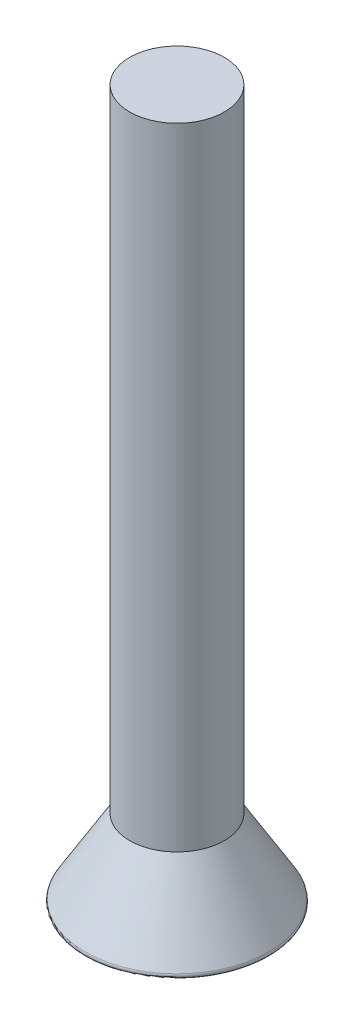
from build123d import *

# Parameters (mm, degrees)
SKETCH1_R           = 3
BOSS_EXTRUDE1_DEPTH = 2.5
SKETCH2_R           = 1.5
BOSS_EXTRUDE2_DEPTH = 20
CHAMFER1_SIZE       = 2.5
CHAMFER1_SIZE_2     = 1.5
FILLET1_R           = 0.1
SKETCH3_W           = 1
SKETCH3_H           = 1
CUT_EXTRUDE2_DEPTH  = 1.5
CHAMFER7_SIZE       = 1.5
CHAMFER7_SIZE_2     = 0.3


with BuildPart() as part:
    # Sketch1 → Boss-Extrude1 (new body)
    with BuildSketch(Plane(origin=(0, 0, 0), x_dir=(1, 0, 0), z_dir=(0, 1, 0))):
        with Locations(Location((0, 0, 0), (0, 0, 270))):
            Circle(SKETCH1_R)
    extrude(amount=BOSS_EXTRUDE1_DEPTH)

    # Sketch2 → Boss-Extrude2 (add)
    with BuildSketch(Plane(origin=(0, 2.5, 0), x_dir=(1, 0, 0), z_dir=(0, 1, 0))):
        with Locations(Location((0, 0, 0), (0, 0, 270))):
            Circle(SKETCH2_R)
    extrude(amount=BOSS_EXTRUDE2_DEPTH)

    # Chamfer1
    # the kernel refuses this chamfer: 2.5, 1.5 mm, written as the material it takes off along each edge
    with BuildSketch(Plane(origin=(0, 2.5, 0), x_dir=(0, 0, 1), z_dir=(-1, 0, 0))) as chamfer1_piece_1_section:
        Polygon((3, -CHAMFER1_SIZE), (3 - CHAMFER1_SIZE_2, 0), (3, 0), align=None)
    chamfer1_piece_1 = revolve(axis=Axis((0, 2.5, 0), (0, 1, 0)), mode=Mode.PRIVATE)
    chamfer1_piece_1 = chamfer1_piece_1 - Plane(origin=(0, 2.5, 0), x_dir=(0, 0, 1), z_dir=(0, -1, 0)) * Cylinder(1.5, 12, mode=Mode.PRIVATE)
    add(chamfer1_piece_1, mode=Mode.SUBTRACT)

    # Fillet1
    fillet1_edges = [part.edges().sort_by_distance(p)[0] for p in [
        (0, 0, -3),
    ]]
    fillet(fillet1_edges, radius=FILLET1_R)

    # Sketch3 → Cut-Extrude2 (cut)
    with BuildSketch(Plane.XZ):
        with Locations((0, -1)):
            Rectangle(SKETCH3_W, SKETCH3_H)
        with Locations((-1, 0)):
            Rectangle(SKETCH3_W, SKETCH3_H)
        Rectangle(SKETCH3_W, SKETCH3_H)
        with Locations((0, 1)):
            Rectangle(SKETCH3_W, SKETCH3_H)
        with Locations((1, 0)):
            Rectangle(SKETCH3_W, SKETCH3_H)
    extrude(amount=-CUT_EXTRUDE2_DEPTH, mode=Mode.SUBTRACT)

    # Chamfer7
    # the kernel refuses this chamfer: 1.5, 0.3 mm, written as the material it adds along each edge
    with BuildSketch(Plane(origin=(-0.5, 1.5, -1.5), x_dir=(0, -1, 0), z_dir=(1, 0, 0)), Plane(origin=(0.5, 1.5, 1.5), x_dir=(0, -1, 0), z_dir=(-1, 0, 0)), Plane(origin=(1.5, 1.5, 0.5), x_dir=(0, -1, 0), z_dir=(-1, 0, 0)), Plane(origin=(-0.5, 1.5, 1.5), x_dir=(0, -1, 0), z_dir=(0, 0, -1)), Plane(origin=(-1.5, 1.5, 0.5), x_dir=(0, -1, 0), z_dir=(0, 0, -1)), Plane(origin=(1.5, 1.5, -0.5), x_dir=(0, -1, 0), z_dir=(0, 0, 1)), Plane(origin=(0.5, 1.5, -0.5), x_dir=(0, -1, 0), z_dir=(1, 0, 0)), Plane(origin=(-1.5, 1.5, -0.5), x_dir=(0, -1, 0), z_dir=(1, 0, 0)), Plane(origin=(-0.5, 1.5, -0.5), x_dir=(0, -1, 0), z_dir=(0, 0, -1))) as chamfer7_piece_1:
        Polygon((CHAMFER7_SIZE, 0), (0, -CHAMFER7_SIZE_2), (0, 0), align=None)
    extrude(amount=1)
    with BuildSketch(Plane(origin=(0.5, 1.5, 1.5), x_dir=(0, -1, 0), z_dir=(0, 0, -1)), Plane(origin=(-1.5, 1.5, 0.5), x_dir=(0, -1, 0), z_dir=(1, 0, 0)), Plane(origin=(0.5, 1.5, -0.5), x_dir=(0, -1, 0), z_dir=(0, 0, -1))) as chamfer7_piece_2:
        Polygon((CHAMFER7_SIZE, 0), (0, CHAMFER7_SIZE_2), (0, 0), align=None)
    extrude(amount=1)
    with BuildSketch(Plane(origin=(0.5, 1.5, 5.397198129), x_dir=(0, -1, 0), z_dir=(0, 0, -1))) as chamfer7_piece_3_section:
        Polygon((CHAMFER7_SIZE, 0), (0, CHAMFER7_SIZE_2), (0, 0), align=None)
    chamfer7_piece_3 = extrude(amount=8.794396259, mode=Mode.PRIVATE)
    chamfer7_piece_3 = split(chamfer7_piece_3, bisect_by=Plane(origin=(0.5, 1.5, -0.5), z_dir=(0, 0, -1)), keep=Keep.TOP, mode=Mode.PRIVATE)
    chamfer7_piece_3 = split(chamfer7_piece_3, bisect_by=Plane(origin=(0.5, 1.5, -1.5), z_dir=(0, 0, 1)), keep=Keep.TOP, mode=Mode.PRIVATE)
    add(chamfer7_piece_3)
    with BuildSketch(Plane(origin=(5.397198129, 1.5, 0.5), x_dir=(0, -1, 0), z_dir=(-1, 0, 0))) as chamfer7_piece_4_section:
        Polygon((CHAMFER7_SIZE, 0), (0, -CHAMFER7_SIZE_2), (0, 0), align=None)
    chamfer7_piece_4 = extrude(amount=8.794396259, mode=Mode.PRIVATE)
    chamfer7_piece_4 = split(chamfer7_piece_4, bisect_by=Plane(origin=(-1.5, 1.5, 0.5), z_dir=(1, 0, 0)), keep=Keep.TOP, mode=Mode.PRIVATE)
    chamfer7_piece_4 = split(chamfer7_piece_4, bisect_by=Plane(origin=(-0.5, 1.5, 0.5), z_dir=(-1, 0, 0)), keep=Keep.TOP, mode=Mode.PRIVATE)
    add(chamfer7_piece_4)
    with BuildSketch(Plane(origin=(-0.5, 1.5, 5.397198129), x_dir=(0, -1, 0), z_dir=(0, 0, -1))) as chamfer7_piece_5_section:
        Polygon((CHAMFER7_SIZE, 0), (0, -CHAMFER7_SIZE_2), (0, 0), align=None)
    chamfer7_piece_5 = extrude(amount=8.794396259, mode=Mode.PRIVATE)
    chamfer7_piece_5 = split(chamfer7_piece_5, bisect_by=Plane(origin=(-0.5, 1.5, -0.5), z_dir=(0, 0, -1)), keep=Keep.TOP, mode=Mode.PRIVATE)
    chamfer7_piece_5 = split(chamfer7_piece_5, bisect_by=Plane(origin=(-0.5, 1.5, -1.5), z_dir=(0, 0, 1)), keep=Keep.TOP, mode=Mode.PRIVATE)
    add(chamfer7_piece_5)
    with BuildSketch(Plane(origin=(-5.397198129, 1.5, 0.5), x_dir=(0, -1, 0), z_dir=(1, 0, 0))) as chamfer7_piece_6_section:
        Polygon((CHAMFER7_SIZE, 0), (0, CHAMFER7_SIZE_2), (0, 0), align=None)
    chamfer7_piece_6 = extrude(amount=8.794396259, mode=Mode.PRIVATE)
    chamfer7_piece_6 = split(chamfer7_piece_6, bisect_by=Plane(origin=(0.5, 1.5, 0.5), z_dir=(1, 0, 0)), keep=Keep.TOP, mode=Mode.PRIVATE)
    chamfer7_piece_6 = split(chamfer7_piece_6, bisect_by=Plane(origin=(1.5, 1.5, 0.5), z_dir=(-1, 0, 0)), keep=Keep.TOP, mode=Mode.PRIVATE)
    add(chamfer7_piece_6)
    with BuildSketch(Plane(origin=(-3.397198129, 1.5, -0.5), x_dir=(0, -1, 0), z_dir=(1, 0, 0))) as chamfer7_piece_7_section:
        Polygon((CHAMFER7_SIZE, 0), (0, -CHAMFER7_SIZE_2), (0, 0), align=None)
    chamfer7_piece_7 = extrude(amount=8.794396259, mode=Mode.PRIVATE)
    chamfer7_piece_7 = split(chamfer7_piece_7, bisect_by=Plane(origin=(-1.5, 1.5, -0.5), z_dir=(1, 0, 0)), keep=Keep.TOP, mode=Mode.PRIVATE)
    chamfer7_piece_7 = split(chamfer7_piece_7, bisect_by=Plane(origin=(-0.5, 1.5, -0.5), z_dir=(-1, 0, 0)), keep=Keep.TOP, mode=Mode.PRIVATE)
    add(chamfer7_piece_7)
    with BuildSketch(Plane(origin=(0.5, 1.5, 3.397198129), x_dir=(0, -1, 0), z_dir=(0, 0, -1))) as chamfer7_piece_8_section:
        Polygon((CHAMFER7_SIZE, 0), (0, CHAMFER7_SIZE_2), (0, 0), align=None)
    chamfer7_piece_8 = extrude(amount=8.794396259, mode=Mode.PRIVATE)
    chamfer7_piece_8 = split(chamfer7_piece_8, bisect_by=Plane(origin=(0.5, 1.5, 1.5), z_dir=(0, 0, -1)), keep=Keep.TOP, mode=Mode.PRIVATE)
    chamfer7_piece_8 = split(chamfer7_piece_8, bisect_by=Plane(origin=(0.5, 1.5, 0.5), z_dir=(0, 0, 1)), keep=Keep.TOP, mode=Mode.PRIVATE)
    add(chamfer7_piece_8)
    with BuildSketch(Plane(origin=(-5.397198129, 1.5, -0.5), x_dir=(0, -1, 0), z_dir=(1, 0, 0))) as chamfer7_piece_9_section:
        Polygon((CHAMFER7_SIZE, 0), (0, -CHAMFER7_SIZE_2), (0, 0), align=None)
    chamfer7_piece_9 = extrude(amount=8.794396259, mode=Mode.PRIVATE)
    chamfer7_piece_9 = split(chamfer7_piece_9, bisect_by=Plane(origin=(1.5, 1.5, -0.5), z_dir=(-1, 0, 0)), keep=Keep.TOP, mode=Mode.PRIVATE)
    chamfer7_piece_9 = split(chamfer7_piece_9, bisect_by=Plane(origin=(0.5, 1.5, -0.5), z_dir=(1, 0, 0)), keep=Keep.TOP, mode=Mode.PRIVATE)
    add(chamfer7_piece_9)
    with BuildSketch(Plane(origin=(-0.5, 1.5, 3.397198129), x_dir=(0, -1, 0), z_dir=(0, 0, -1))) as chamfer7_piece_10_section:
        Polygon((CHAMFER7_SIZE, 0), (0, -CHAMFER7_SIZE_2), (0, 0), align=None)
    chamfer7_piece_10 = extrude(amount=8.794396259, mode=Mode.PRIVATE)
    chamfer7_piece_10 = split(chamfer7_piece_10, bisect_by=Plane(origin=(-0.5, 1.5, 0.5), z_dir=(0, 0, 1)), keep=Keep.TOP, mode=Mode.PRIVATE)
    chamfer7_piece_10 = split(chamfer7_piece_10, bisect_by=Plane(origin=(-0.5, 1.5, 1.5), z_dir=(0, 0, -1)), keep=Keep.TOP, mode=Mode.PRIVATE)
    add(chamfer7_piece_10)
    with BuildSketch(Plane(origin=(0.5, 1.5, 1.5), x_dir=(0, -1, 0), z_dir=(0, 0, -1))) as chamfer7_piece_11a_section:
        Polygon((CHAMFER7_SIZE, 0), (0, CHAMFER7_SIZE_2), (0, 0), align=None)
    chamfer7_piece_11a = extrude(amount=4.897198129, mode=Mode.PRIVATE)
    chamfer7_piece_11a = split(chamfer7_piece_11a, bisect_by=Plane(origin=(0.5, 1.5, 0.5), z_dir=(0, 0, -1)), keep=Keep.TOP, mode=Mode.PRIVATE)
    chamfer7_piece_11a = split(chamfer7_piece_11a, bisect_by=Plane(origin=(0.5, 1.5, -0.5), z_dir=(0, 0, 1)), keep=Keep.TOP, mode=Mode.PRIVATE)
    with BuildSketch(Plane(origin=(1.5, 1.5, 0.5), x_dir=(0, -1, 0), z_dir=(-1, 0, 0))) as chamfer7_piece_11b_section:
        Polygon((CHAMFER7_SIZE, 0), (0, -CHAMFER7_SIZE_2), (0, 0), align=None)
    chamfer7_piece_11b = extrude(amount=4.897198129, mode=Mode.PRIVATE)
    chamfer7_piece_11b = split(chamfer7_piece_11b, bisect_by=Plane(origin=(-0.5, 1.5, 0.5), z_dir=(1, 0, 0)), keep=Keep.TOP, mode=Mode.PRIVATE)
    chamfer7_piece_11b = split(chamfer7_piece_11b, bisect_by=Plane(origin=(0.5, 1.5, 0.5), z_dir=(-1, 0, 0)), keep=Keep.TOP, mode=Mode.PRIVATE)
    chamfer7_piece_11 = chamfer7_piece_11a & chamfer7_piece_11b
    add(chamfer7_piece_11)
    with BuildSketch(Plane(origin=(-1.5, 1.5, 0.5), x_dir=(0, -1, 0), z_dir=(1, 0, 0))) as chamfer7_piece_12a_section:
        Polygon((CHAMFER7_SIZE, 0), (0, CHAMFER7_SIZE_2), (0, 0), align=None)
    chamfer7_piece_12a = extrude(amount=4.897198129, mode=Mode.PRIVATE)
    chamfer7_piece_12a = split(chamfer7_piece_12a, bisect_by=Plane(origin=(-0.5, 1.5, 0.5), z_dir=(1, 0, 0)), keep=Keep.TOP, mode=Mode.PRIVATE)
    chamfer7_piece_12a = split(chamfer7_piece_12a, bisect_by=Plane(origin=(0.5, 1.5, 0.5), z_dir=(-1, 0, 0)), keep=Keep.TOP, mode=Mode.PRIVATE)
    with BuildSketch(Plane(origin=(-0.5, 1.5, 1.5), x_dir=(0, -1, 0), z_dir=(0, 0, -1))) as chamfer7_piece_12b_section:
        Polygon((CHAMFER7_SIZE, 0), (0, -CHAMFER7_SIZE_2), (0, 0), align=None)
    chamfer7_piece_12b = extrude(amount=4.897198129, mode=Mode.PRIVATE)
    chamfer7_piece_12b = split(chamfer7_piece_12b, bisect_by=Plane(origin=(-0.5, 1.5, -0.5), z_dir=(0, 0, 1)), keep=Keep.TOP, mode=Mode.PRIVATE)
    chamfer7_piece_12b = split(chamfer7_piece_12b, bisect_by=Plane(origin=(-0.5, 1.5, 0.5), z_dir=(0, 0, -1)), keep=Keep.TOP, mode=Mode.PRIVATE)
    chamfer7_piece_12 = chamfer7_piece_12a & chamfer7_piece_12b
    add(chamfer7_piece_12)
    with BuildSketch(Plane(origin=(-3.397198129, 1.5, -0.5), x_dir=(0, -1, 0), z_dir=(1, 0, 0))) as chamfer7_piece_13a_section:
        Polygon((CHAMFER7_SIZE, 0), (0, -CHAMFER7_SIZE_2), (0, 0), align=None)
    chamfer7_piece_13a = extrude(amount=4.897198129, mode=Mode.PRIVATE)
    chamfer7_piece_13a = split(chamfer7_piece_13a, bisect_by=Plane(origin=(0.5, 1.5, -0.5), z_dir=(-1, 0, 0)), keep=Keep.TOP, mode=Mode.PRIVATE)
    chamfer7_piece_13a = split(chamfer7_piece_13a, bisect_by=Plane(origin=(-0.5, 1.5, -0.5), z_dir=(1, 0, 0)), keep=Keep.TOP, mode=Mode.PRIVATE)
    with BuildSketch(Plane(origin=(0.5, 1.5, 3.397198129), x_dir=(0, -1, 0), z_dir=(0, 0, -1))) as chamfer7_piece_13b_section:
        Polygon((CHAMFER7_SIZE, 0), (0, CHAMFER7_SIZE_2), (0, 0), align=None)
    chamfer7_piece_13b = extrude(amount=4.897198129, mode=Mode.PRIVATE)
    chamfer7_piece_13b = split(chamfer7_piece_13b, bisect_by=Plane(origin=(0.5, 1.5, 0.5), z_dir=(0, 0, -1)), keep=Keep.TOP, mode=Mode.PRIVATE)
    chamfer7_piece_13b = split(chamfer7_piece_13b, bisect_by=Plane(origin=(0.5, 1.5, -0.5), z_dir=(0, 0, 1)), keep=Keep.TOP, mode=Mode.PRIVATE)
    chamfer7_piece_13 = chamfer7_piece_13a & chamfer7_piece_13b
    add(chamfer7_piece_13)
    with BuildSketch(Plane(origin=(-1.5, 1.5, -0.5), x_dir=(0, -1, 0), z_dir=(1, 0, 0))) as chamfer7_piece_14a_section:
        Polygon((CHAMFER7_SIZE, 0), (0, -CHAMFER7_SIZE_2), (0, 0), align=None)
    chamfer7_piece_14a = extrude(amount=4.897198129, mode=Mode.PRIVATE)
    chamfer7_piece_14a = split(chamfer7_piece_14a, bisect_by=Plane(origin=(0.5, 1.5, -0.5), z_dir=(-1, 0, 0)), keep=Keep.TOP, mode=Mode.PRIVATE)
    chamfer7_piece_14a = split(chamfer7_piece_14a, bisect_by=Plane(origin=(-0.5, 1.5, -0.5), z_dir=(1, 0, 0)), keep=Keep.TOP, mode=Mode.PRIVATE)
    with BuildSketch(Plane(origin=(-0.5, 1.5, 3.397198129), x_dir=(0, -1, 0), z_dir=(0, 0, -1))) as chamfer7_piece_14b_section:
        Polygon((CHAMFER7_SIZE, 0), (0, -CHAMFER7_SIZE_2), (0, 0), align=None)
    chamfer7_piece_14b = extrude(amount=4.897198129, mode=Mode.PRIVATE)
    chamfer7_piece_14b = split(chamfer7_piece_14b, bisect_by=Plane(origin=(-0.5, 1.5, -0.5), z_dir=(0, 0, 1)), keep=Keep.TOP, mode=Mode.PRIVATE)
    chamfer7_piece_14b = split(chamfer7_piece_14b, bisect_by=Plane(origin=(-0.5, 1.5, 0.5), z_dir=(0, 0, -1)), keep=Keep.TOP, mode=Mode.PRIVATE)
    chamfer7_piece_14 = chamfer7_piece_14a & chamfer7_piece_14b
    add(chamfer7_piece_14)


solid = part.part
